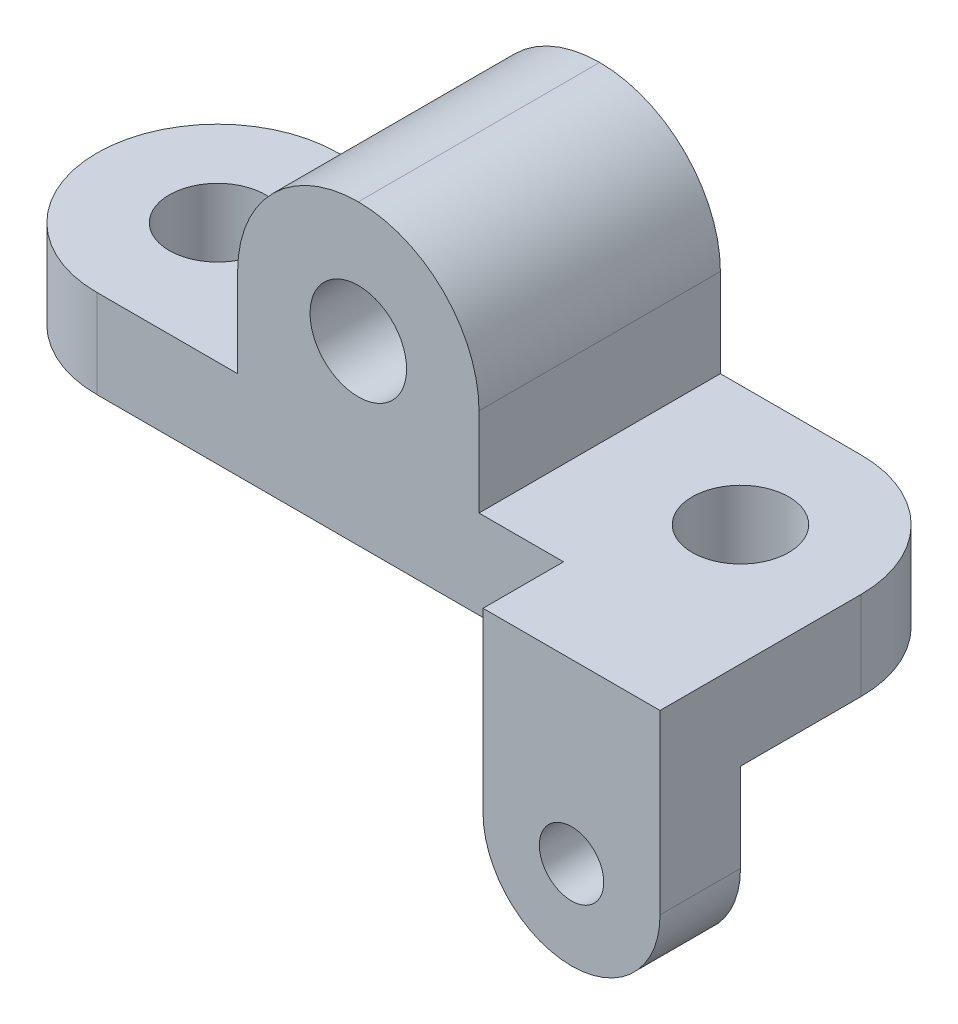
from build123d import *
from OCP.BRepFilletAPI import BRepFilletAPI_MakeFillet

# Parameters (mm, degrees)
SKETCH1_R                = 12
BOSS_EXTRUDE1_DEPTH      = 22
BOSS_EXTRUDE1_2_DEPTH    = 22
SKETCH1_3_W              = 60
SKETCH1_3_H              = 60
BOSS_EXTRUDE2_DEPTH      = 74
BOSS_EXTRUDE3_DEPTH      = 22
BOSS_EXTRUDE3_DEPTH_BACK = 44
SKETCH1_4_W              = 44
SKETCH1_4_H              = 20
FILLET1_R                = 30
FILLET1_R_2              = 22
CUT_EXTRUDE1_DEPTH       = 131.387882873
CUT_EXTRUDE1_DEPTH_BACK  = 131.387882873
SKETCH2_R                = 12
SKETCH2_R_2              = 8


with BuildPart() as part:
    # Sketch1 → Boss-Extrude1 (new body)
    with BuildSketch(Plane(origin=(0, 0, 0), x_dir=(1, 0, 0), z_dir=(0, 1, 0))):
        with BuildLine():
            Line((-65, -30), (-30, -30))
            Line((-30, -30), (-30, 30))
            Line((-30, 30), (-65, 30))
            ThreePointArc((-65, 30), (-95, 0), (-65, -30))
        make_face()
        with Locations(Location((-65, 0, 0), (0, 0, 270))):
            Circle(SKETCH1_R, mode=Mode.SUBTRACT)
    extrude(amount=BOSS_EXTRUDE1_DEPTH)



with BuildPart() as body_2:
    # Sketch1 → Boss-Extrude1 2 (new body)
    with BuildSketch(Plane(origin=(0, 0, 0), x_dir=(1, 0, 0), z_dir=(0, 1, 0))):
        with BuildLine():
            Line((51, -30), (95, -30))
            Line((95, -30), (95, 0))
            ThreePointArc((95, 0), (86.213203436, 21.213203436), (65, 30))
            Line((65, 30), (30, 30))
            Line((30, 30), (30, -30))
            Line((30, -30), (51, -30))
        make_face()
        with Locations(Location((65, 0, 0), (0, 0, 270))):
            Circle(SKETCH1_R, mode=Mode.SUBTRACT)
    extrude(amount=BOSS_EXTRUDE1_2_DEPTH)


with BuildPart() as part_1:
    add(part.part)

    add(body_2.part)  # Boss-Extrude2 merges body 2
    # Sketch1<3> → Boss-Extrude2 (add)
    with BuildSketch(Plane(origin=(0, 0, 0), x_dir=(1, 0, 0), z_dir=(0, 1, 0))):
        Rectangle(SKETCH1_3_W, SKETCH1_3_H)
    extrude(amount=BOSS_EXTRUDE2_DEPTH)

    # Sketch1<4> → Boss-Extrude3 (add, two sides: drawn at the far end of the back side and taken through both)
    with BuildSketch(Plane(origin=(0, 0, 0), x_dir=(1, 0, 0), z_dir=(0, 1, 0)).offset(-BOSS_EXTRUDE3_DEPTH_BACK)):
        with Locations((73, -40)):
            Rectangle(SKETCH1_4_W, SKETCH1_4_H)
    extrude(amount=BOSS_EXTRUDE3_DEPTH + BOSS_EXTRUDE3_DEPTH_BACK)

    # Fillet1
    fillet1_edges_1 = [part_1.edges().sort_by_distance(p)[0] for p in [
        (30, 74, 0),
        (-30, 74, 0),
    ]]
    fillet1_edges_2 = [part_1.edges().sort_by_distance(p)[0] for p in [
        (95, -44, 40),
        (51, -44, 40),
    ]]
    fillet1 = BRepFilletAPI_MakeFillet(part_1.part.solid().wrapped)
    for e in fillet1_edges_1:
        fillet1.Add(FILLET1_R - 0.0001, e.wrapped)
    for e in fillet1_edges_2:
        fillet1.Add(FILLET1_R_2 - 0.0001, e.wrapped)
    add(Compound.cast(fillet1.Shape()), mode=Mode.REPLACE)  # a hair under: the kernel refuses the full size

    # Sketch2 → Cut-Extrude1 (cut, two sides: drawn at the far end of the back side and taken through both)
    with BuildSketch(Plane.XY.offset(-CUT_EXTRUDE1_DEPTH_BACK)):
        with Locations((0, 44)):
            Circle(SKETCH2_R)
        with Locations((73, -22)):
            Circle(SKETCH2_R_2)
    extrude(amount=CUT_EXTRUDE1_DEPTH + CUT_EXTRUDE1_DEPTH_BACK, mode=Mode.SUBTRACT)


solid = part_1.part
